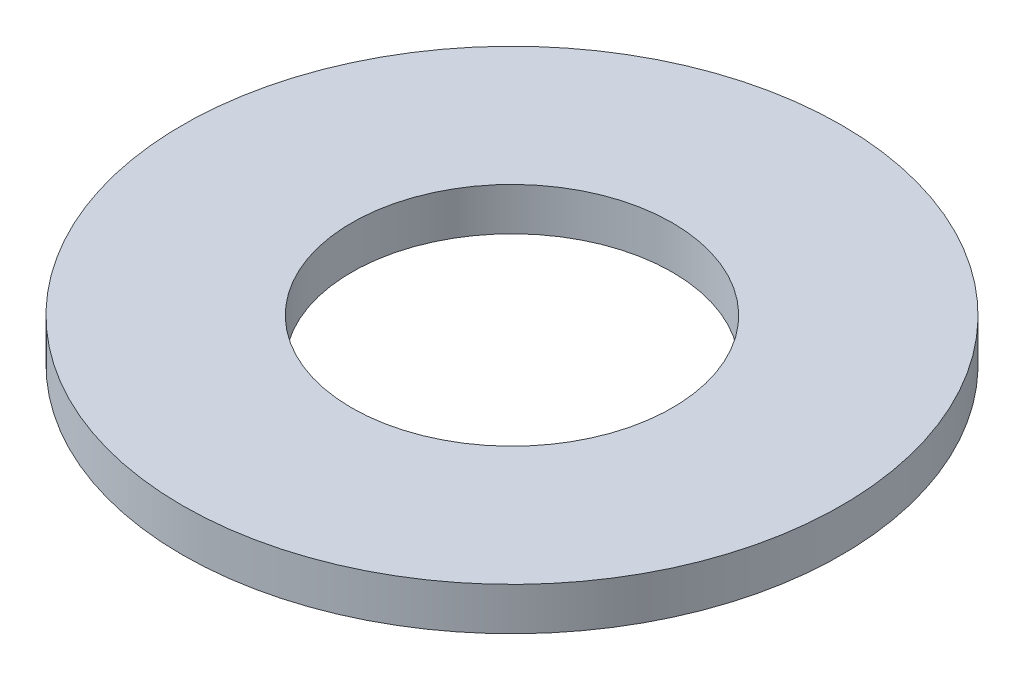
from build123d import *

# Parameters (mm, degrees)
SKETCH1_R           = 9.25
SKETCH1_R_2         = 4.5
BOSS_EXTRUDE1_DEPTH = 1.2


with BuildPart() as part:
    # Sketch1 → Boss-Extrude1 (new body)
    with BuildSketch(Plane(origin=(0, 0, 0), x_dir=(1, 0, 0), z_dir=(0, 1, 0))):
        Circle(SKETCH1_R)
        Circle(SKETCH1_R_2, mode=Mode.SUBTRACT)
    extrude(amount=-BOSS_EXTRUDE1_DEPTH)


solid = part.part
